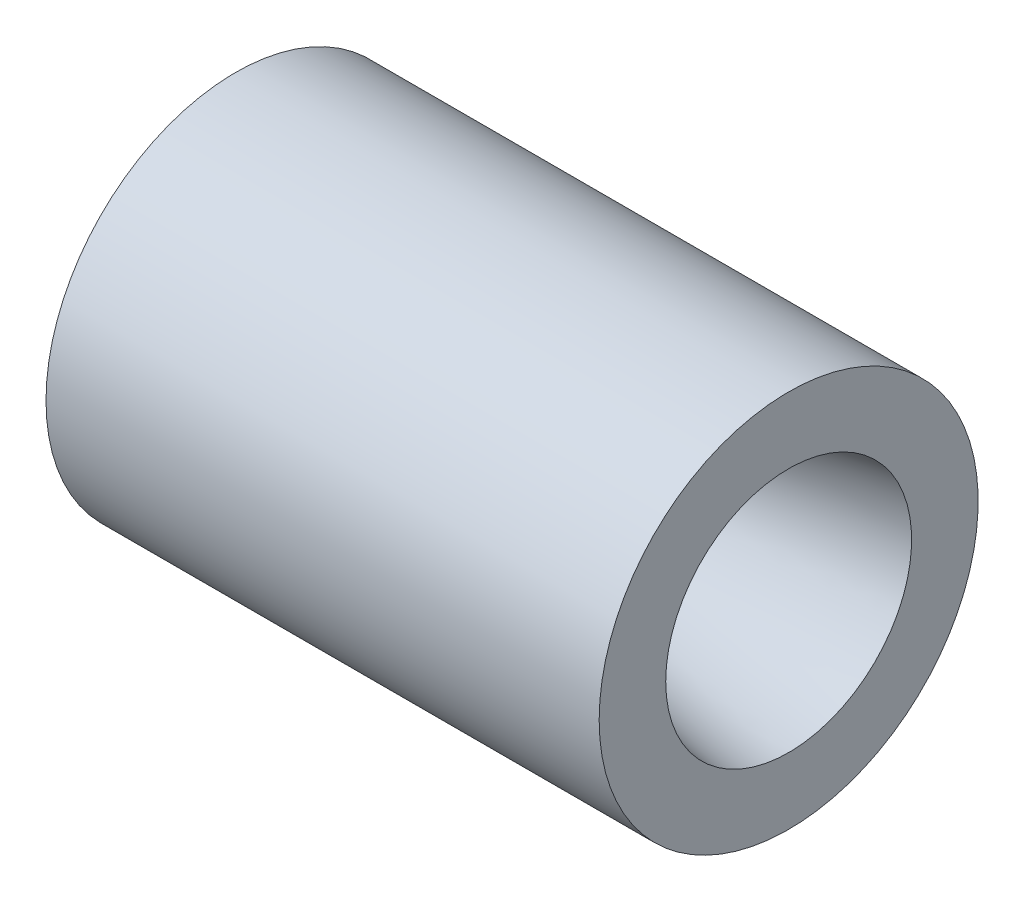
from build123d import *


with BuildPart() as part:
    # Sketch1 → Revolve1 (revolve)
    with BuildSketch(Plane.XY):
        with BuildLine():
            Line((42.945252988, 29.825549705), (62.812385376, 18.355255472))
            ThreePointArc((62.812385376, 18.355255472), (68.271514292, 16.084070702), (74.13, 15.285))
            ThreePointArc((74.13, 15.285), (75.042634026, 15.351014858), (75.933754417, 15.558772587))
            add(Edge.make_bspline(
                [(75.933754417, 15.558772587), (97.124186968, 22.913189408), (126.012294015, 29.837045564), (148.34, 32.975)],
                knots=[0, 0, 0, 0, 1, 1, 1, 1], degree=3))
            Line((148.34, 32.975), (148.34, 50.82))
            Line((148.34, 50.82), (0, 50.82))
            Line((0, 50.82), (0, 41.295))
            ThreePointArc((0, 41.295), (22.230006991, 38.396147211), (42.945252988, 29.825549705))
        make_face()
    revolve(axis=Axis((0, 0, 0), (1, 0, 0)))


solid = part.part
